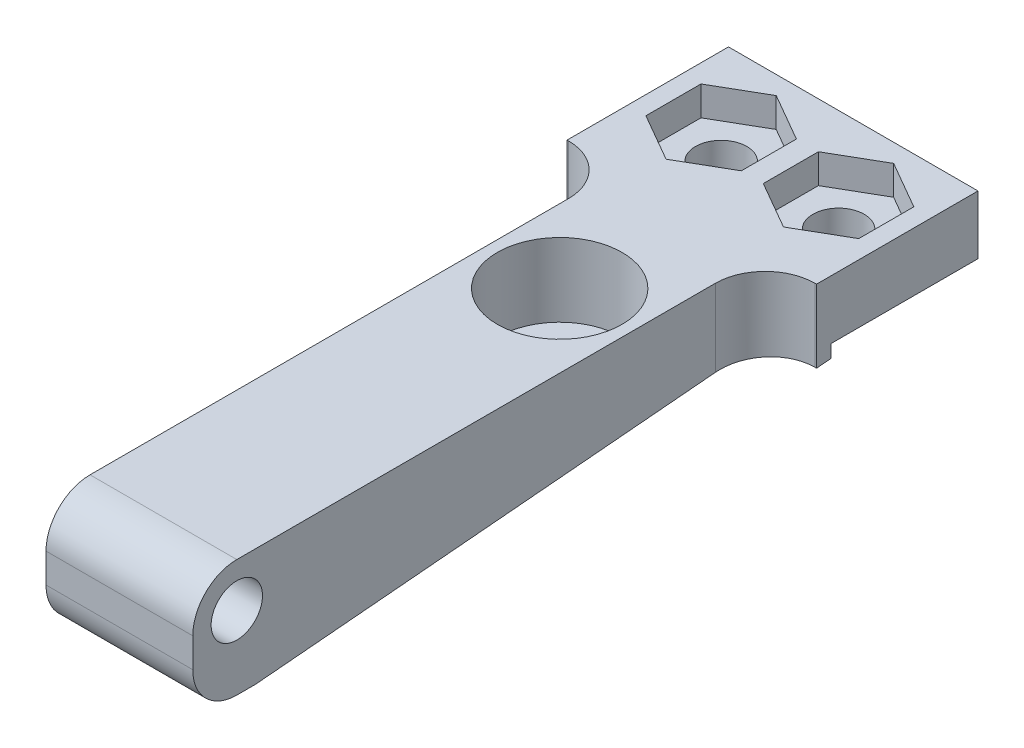
from build123d import *

# Parameters (mm, degrees)
SKETCH1_R           = 1.75
BOSS_EXTRUDE1_DEPTH = 8.5
FILLET1_R           = 3
SKETCH2_R           = 1.75
CUT_EXTRUDE1_DEPTH  = 49.427781283
SKETCH2_3_R         = 1.75
CUT_EXTRUDE2_DEPTH  = 2
SKETCH3_R           = 4.25
CUT_EXTRUDE3_DEPTH  = 5
CUT_EXTRUDE4_REACH  = 50.428


with BuildPart() as part:
    # Sketch1 → Boss-Extrude1 (new, symmetric)
    with BuildSketch(Plane(origin=(0, 0, 0), x_dir=(0, 0, -1), z_dir=(1, 0, 0))):
        with BuildLine():
            ThreePointArc((0, 3), (-2.121320344, 2.121320344), (-3, 0))
            Line((-3, 0), (-3, -5))
            Line((-3, -5), (1.279790789, -5))
            Line((1.279790789, -5), (37, -1.874886635))
            Line((37, -1.874886635), (37, -1))
            Line((37, -1), (47, -1))
            Line((47, -1), (47, 3))
            Line((47, 3), (0, 3))
        make_face()
        Circle(SKETCH1_R, mode=Mode.SUBTRACT)
    extrude(amount=BOSS_EXTRUDE1_DEPTH, both=True)

    # Fillet1
    fillet1_edges = [part.edges().sort_by_distance(p)[0] for p in [
        (0, -5, 3),
    ]]
    fillet(fillet1_edges, radius=FILLET1_R)

    # Sketch2 → Cut-Extrude1 (cut, through all)
    with BuildSketch(Plane(origin=(0, 3, 0), x_dir=(1, 0, 0), z_dir=(0, 1, 0))):
        with Locations((-4, 42)):
            Circle(SKETCH2_R)
        with Locations((4, 42)):
            Circle(SKETCH2_R)
    extrude(amount=-CUT_EXTRUDE1_DEPTH, mode=Mode.SUBTRACT)

    # Sketch2<3> → Cut-Extrude2 (cut)
    # profile 1 of 2: a face of its own
    with BuildSketch(Plane(origin=(0, 3, 0), x_dir=(1, 0, 0), z_dir=(0, 1, 0))):
        Polygon((0.75, 43.876388375), (0.75, 40.123611625), (4, 38.24722325), (7.25, 40.123611625), (7.25, 43.876388375), (4, 45.75277675), align=None)
        with Locations((4, 42)):
            Circle(SKETCH2_3_R, mode=Mode.SUBTRACT)
    # profile 2 of 2: a face of its own
    with BuildSketch(Plane(origin=(0, 3, 0), x_dir=(1, 0, 0), z_dir=(0, 1, 0))):
        Polygon((-0.75, 40.123611625), (-0.75, 43.876388375), (-4, 45.75277675), (-7.25, 43.876388375), (-7.25, 40.123611625), (-4, 38.24722325), align=None)
        with Locations((-4, 42)):
            Circle(SKETCH2_3_R, mode=Mode.SUBTRACT)
    extrude(amount=-CUT_EXTRUDE2_DEPTH, mode=Mode.SUBTRACT)

    # Sketch3 → Cut-Extrude3 (cut)
    with BuildSketch(Plane(origin=(0, 3, 0), x_dir=(1, 0, 0), z_dir=(0, 1, 0))):
        with Locations((0, 27)):
            Circle(SKETCH3_R)
    extrude(amount=-CUT_EXTRUDE3_DEPTH, mode=Mode.SUBTRACT)

    # Sketch4 → Cut-Extrude4 (cut, up to next)
    with BuildSketch(Plane(origin=(0, 3, 0), x_dir=(1, 0, 0), z_dir=(0, 1, 0)), mode=Mode.PRIVATE) as cut_extrude4_sk1:
        with BuildLine():
            Line((-8.5, -3), (-5, -3))
            Line((-5, -3), (-5, 32.6))
            ThreePointArc((-5, 32.6), (-5.995836944, 35.004163056), (-8.4, 36))
            Line((-8.4, 36), (-8.5, 36))
            Line((-8.5, 36), (-8.5, -3))
        make_face()
    cut_extrude4_tool1 = extrude(cut_extrude4_sk1.sketch, amount=-CUT_EXTRUDE4_REACH, mode=Mode.PRIVATE) & part.part
    # Sketch4 → Cut-Extrude4 (cut, up to next)
    with BuildSketch(Plane(origin=(0, 3, 0), x_dir=(1, 0, 0), z_dir=(0, 1, 0)), mode=Mode.PRIVATE) as cut_extrude4_sk2:
        with BuildLine():
            Line((8.4, 36), (8.5, 36))
            Line((8.5, 36), (8.5, -3))
            Line((8.5, -3), (5, -3))
            Line((5, -3), (5, 32.6))
            ThreePointArc((5, 32.6), (5.995836944, 35.004163056), (8.4, 36))
        make_face()
    cut_extrude4_tool2 = extrude(cut_extrude4_sk2.sketch, amount=-CUT_EXTRUDE4_REACH, mode=Mode.PRIVATE) & part.part
    add(cut_extrude4_tool1.solids().sort_by_distance((-6.768336, 3, -16.153098))[0], mode=Mode.SUBTRACT)
    add(cut_extrude4_tool2.solids().sort_by_distance((6.768336, 3, -16.153098))[0], mode=Mode.SUBTRACT)


solid = part.part
